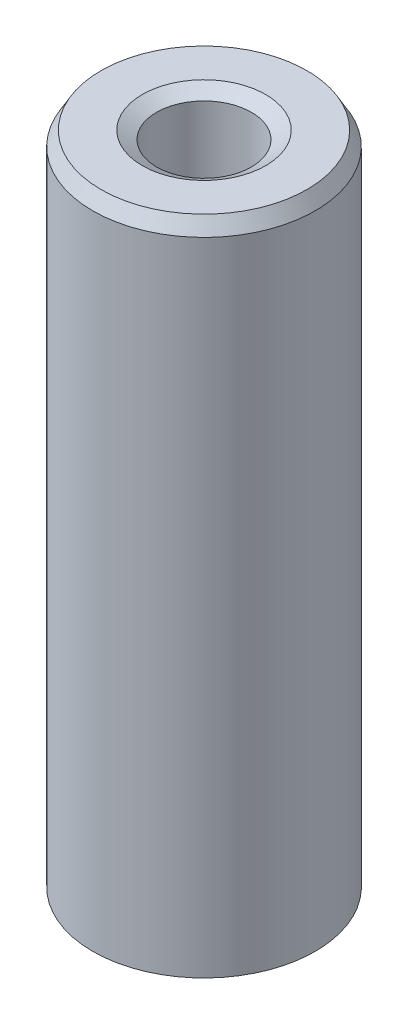
from build123d import *
from OCP.BRepFilletAPI import BRepFilletAPI_MakeChamfer

# Parameters (mm, degrees)
SKETCH1_R           = 20
BOSS_EXTRUDE1_DEPTH = 119.353758607
SKETCH2_R           = 8.52141801
CUT_EXTRUDE1_DEPTH  = 123.659364476
CHAMFER1_SIZE       = 2.569712237
CHAMFER1_SIZE2      = 1.483624052


with BuildPart() as part:
    # Sketch1 → Boss-Extrude1 (new body)
    with BuildSketch(Plane(origin=(0, 0, 0), x_dir=(1, 0, 0), z_dir=(0, 1, 0))):
        Circle(SKETCH1_R)
    extrude(amount=BOSS_EXTRUDE1_DEPTH)

    # Sketch2 → Cut-Extrude1 (cut, through all)
    with BuildSketch(Plane(origin=(0, 0, 0), x_dir=(1, 0, 0), z_dir=(0, 1, 0))):
        Circle(SKETCH2_R)
    extrude(amount=CUT_EXTRUDE1_DEPTH, mode=Mode.SUBTRACT)

    # Chamfer1: one chamfer whose edges measure the first distance from different faces: ONE call of the kernel's chamfer builder (chamfer() names one face for all edges)
    chamfer1_edges_1 = [part.edges().sort_by_distance(p)[0] for p in [
        (-8.52141801, 119.353758607, 0),
    ]]
    chamfer1_side_1 = [part.faces().sort_by_distance(p)[0] for p in [
        (-19.434314575, 119.353758607, 0),
    ]]
    chamfer1_edges_2 = [part.edges().sort_by_distance(p)[0] for p in [
        (-8.52141801, 0, 0),
    ]]
    chamfer1_side_2 = [part.faces().sort_by_distance(p)[0] for p in [
        (-8.52141801, 59.676879304, 0),
    ]]
    chamfer1_edges_3 = [part.edges().sort_by_distance(p)[0] for p in [
        (-20, 0, 0),
    ]]
    chamfer1_side_3 = [part.faces().sort_by_distance(p)[0] for p in [
        (-19.434314575, 0, 0),
    ]]
    chamfer1_edges_4 = [part.edges().sort_by_distance(p)[0] for p in [
        (-20, 119.353758607, 0),
    ]]
    chamfer1_side_4 = [part.faces().sort_by_distance(p)[0] for p in [
        (-20, 59.676879304, 0),
    ]]
    chamfer1 = BRepFilletAPI_MakeChamfer(part.part.solid().wrapped)
    for e in chamfer1_edges_1:
        chamfer1.Add(CHAMFER1_SIZE, CHAMFER1_SIZE2, e.wrapped, chamfer1_side_1[0].wrapped)  # the first distance lies on this face
    for e in chamfer1_edges_2:
        chamfer1.Add(CHAMFER1_SIZE, CHAMFER1_SIZE2, e.wrapped, chamfer1_side_2[0].wrapped)  # the first distance lies on this face
    for e in chamfer1_edges_3:
        chamfer1.Add(CHAMFER1_SIZE, CHAMFER1_SIZE2, e.wrapped, chamfer1_side_3[0].wrapped)  # the first distance lies on this face
    for e in chamfer1_edges_4:
        chamfer1.Add(CHAMFER1_SIZE, CHAMFER1_SIZE2, e.wrapped, chamfer1_side_4[0].wrapped)  # the first distance lies on this face
    add(Compound.cast(chamfer1.Shape()), mode=Mode.REPLACE)


solid = part.part
